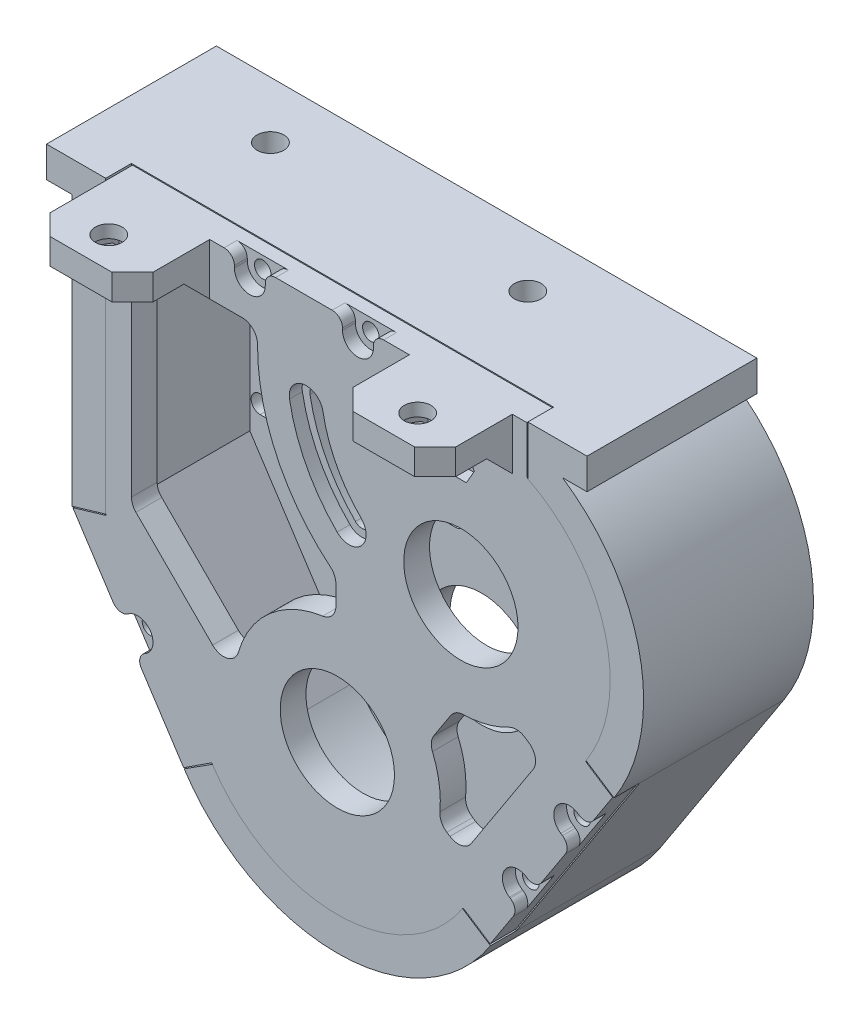
from build123d import *

# Parameters (mm, degrees)
SKETCH1_R           = 11.1
BOSS_EXTRUDE1_DEPTH = 5
BOSS_EXTRUDE2_DEPTH = 28
SKETCH4_W           = 105
SKETCH4_H           = 28
BOSS_EXTRUDE3_DEPTH = 6
BOSS_EXTRUDE4_DEPTH = 5
BOSS_EXTRUDE6_DEPTH = 5
CUT_EXTRUDE1_START  = -5
SKETCH7_R           = 11.1
CUT_EXTRUDE1_DEPTH  = 5
SKETCH8_R           = 1.85
CUT_EXTRUDE2_DEPTH  = 2.5
SKETCH8_2_R         = 1.85
CUT_EXTRUDE3_DEPTH  = 5
CUT_EXTRUDE4_DEPTH  = 5
CUT_EXTRUDE5_DEPTH  = 2.5
SKETCH11_W          = 20
SKETCH11_H          = 5
BOSS_EXTRUDE7_DEPTH = 15
CUT_EXTRUDE6_DEPTH  = 2.5
SKETCH12_3_R        = 1.6
CUT_EXTRUDE7_DEPTH  = 5
CUT_EXTRUDE8_DEPTH  = 5
SKETCH16_R          = 2.6
CUT_EXTRUDE9_DEPTH  = 2.5
SKETCH16_2_R        = 2.6
CUT_EXTRUDE10_DEPTH = 140.834848804
SKETCH17_R          = 2.6
CUT_EXTRUDE11_DEPTH = 2.5
SKETCH17_3_R        = 2.6
CUT_EXTRUDE12_DEPTH = 141.78017688
SKETCH18_R          = 1.5
CUT_EXTRUDE13_DEPTH = 8
CHAMFER1_SIZE       = 4
CHAMFER2_SIZE       = 5
FILLET3_R           = 3
FILLET4_R           = 3
FILLET5_R           = 2


with BuildPart() as part:
    # Sketch1 → Boss-Extrude1 (new body)
    with BuildSketch(Plane.XY):
        with BuildLine():
            Line((-21, -21), (-0.282868992, -52.731955723))
            ThreePointArc((-0.282868992, -52.731955723), (24.021245285, -65.878170047), (48.306071751, -52.696359647))
            Line((48.306071751, -52.696359647), (72.306071751, -15.818181818))
            ThreePointArc((72.306071751, -15.818181818), (73.492423117, 13.825207544), (48, 29))
            Line((48, 29), (-21, 29))
            Line((-21, 29), (-21, -21))
        make_face()
        with BuildLine():
            ThreePointArc((-19, -17.25), (-20.75, -15.5), (-19, -13.75))
            Line((-19, -13.75), (-12, -13.75))
            ThreePointArc((-12, -13.75), (-10.25, -15.5), (-12, -17.25))
            Line((-12, -17.25), (-19, -17.25))
        make_face(mode=Mode.SUBTRACT)
        with BuildLine():
            ThreePointArc((-3.5, -11.1), (-14.6, 0), (-3.5, 11.1))
            Line((-3.5, 11.1), (3.5, 11.1))
            ThreePointArc((3.5, 11.1), (14.6, 0), (3.5, -11.1))
            Line((3.5, -11.1), (-3.5, -11.1))
        make_face(mode=Mode.SUBTRACT)
        with BuildLine():
            ThreePointArc((-19, 13.75), (-20.75, 15.5), (-19, 17.25))
            Line((-19, 17.25), (-12, 17.25))
            ThreePointArc((-12, 17.25), (-10.25, 15.5), (-12, 13.75))
            Line((-12, 13.75), (-19, 13.75))
        make_face(mode=Mode.SUBTRACT)
        with BuildLine():
            ThreePointArc((12, 13.75), (10.25, 15.5), (12, 17.25))
            Line((12, 17.25), (19, 17.25))
            ThreePointArc((19, 17.25), (20.75, 15.5), (19, 13.75))
            Line((19, 13.75), (12, 13.75))
        make_face(mode=Mode.SUBTRACT)
        with BuildLine():
            Line((12, -13.75), (19, -13.75))
            ThreePointArc((19, -13.75), (20.75, -15.5), (19, -17.25))
            Line((19, -17.25), (12, -17.25))
            ThreePointArc((12, -17.25), (10.25, -15.5), (12, -13.75))
        make_face(mode=Mode.SUBTRACT)
        with Locations((24, -36.878177829)):
            Circle(SKETCH1_R, mode=Mode.SUBTRACT)
        with Locations((48, 0)):
            Circle(SKETCH1_R, mode=Mode.SUBTRACT)
    extrude(amount=BOSS_EXTRUDE1_DEPTH)

    # Sketch3 → Boss-Extrude2 (add)
    with BuildSketch(Plane(origin=(0, 0, 0), x_dir=(-1, 0, 0), z_dir=(0, 0, -1))):
        with BuildLine():
            Line((27.5, -22.934009153), (27.5, 35.5))
            Line((27.5, 35.5), (-48, 35.5))
            ThreePointArc((-48, 35.5), (-79.206242091, 16.923960959), (-77.753984385, -19.363636364))
            Line((-77.753984385, -19.363636364), (-53.753984385, -56.241814193))
            ThreePointArc((-53.753984385, -56.241814193), (-24.02600716, -72.378168303), (5.725581008, -56.285388699))
            Line((5.725581008, -56.285388699), (27.5, -22.934009153))
        make_face()
        with BuildLine():
            Line((21, -21), (21, 29))
            Line((21, 29), (-48, 29))
            ThreePointArc((-48, 29), (-73.492423117, 13.825207544), (-72.306071751, -15.818181818))
            Line((-72.306071751, -15.818181818), (-48.306071751, -52.696359647))
            ThreePointArc((-48.306071751, -52.696359647), (-24.021245285, -65.878170047), (0.282868992, -52.731955723))
            Line((0.282868992, -52.731955723), (21, -21))
        make_face(mode=Mode.SUBTRACT)
    extrude(amount=-BOSS_EXTRUDE2_DEPTH)

    # Sketch4 → Boss-Extrude3 (add)
    with BuildSketch(Plane(origin=(0, 35.5, 0), x_dir=(1, 0, 0), z_dir=(0, 1, 0))):
        with Locations((20, -14)):
            Rectangle(SKETCH4_W, SKETCH4_H)
    extrude(amount=-BOSS_EXTRUDE3_DEPTH)

    # Sketch5 → Boss-Extrude4 (add)
    with BuildSketch(Plane.XY.offset(28)):
        Polygon((-21, -21), (-21, 35.5), (-32.5, 35.5), (-32.5, 29.5), (-27.5, 29.5), (-27.5, -22.934009153), align=None)
        with BuildLine():
            ThreePointArc((77.753984385, -19.363636364), (82.778379659, 7.121397919), (67.748417658, 29.5))
            Line((67.748417658, 29.5), (72.5, 29.5))
            Line((72.5, 29.5), (72.5, 35.5))
            Line((72.5, 35.5), (61, 35.5))
            Line((61, 35.5), (61, 25.922962794))
            ThreePointArc((61, 25.922962794), (75.991365378, 7.581785031), (72.306071751, -15.818181818))
            Line((72.306071751, -15.818181818), (77.753984385, -19.363636364))
        make_face()
        with BuildLine():
            ThreePointArc((48.306071751, -52.696359647), (24.021245285, -65.878170047), (-0.282868992, -52.731955723))
            Line((-0.282868992, -52.731955723), (-5.753984385, -56.241814193))
            ThreePointArc((-5.753984385, -56.241814193), (24, -72.378177829), (53.753984385, -56.241814193))
            Line((53.753984385, -56.241814193), (48.306071751, -52.696359647))
        make_face()
    extrude(amount=BOSS_EXTRUDE4_DEPTH)

    # Sketch16 → Cut-Extrude9 (cut)
    # profile 1 of 2: a face of its own
    with BuildSketch(Plane.XZ.offset(-29)):
        Polygon((44.542562584, 11), (41.771281292, 15.8), (36.228718708, 15.8), (33.457437416, 11), (36.228718708, 6.2), (41.771281292, 6.2), align=None)
        with Locations((39, 11)):
            Circle(SKETCH16_R, mode=Mode.SUBTRACT)
    # profile 2 of 2: a face of its own
    with BuildSketch(Plane.XZ.offset(-29)):
        Polygon((-5.457437416, 11), (-8.228718708, 15.8), (-13.771281292, 15.8), (-16.542562584, 11), (-13.771281292, 6.2), (-8.228718708, 6.2), align=None)
        with Locations((-11, 11)):
            Circle(SKETCH16_R, mode=Mode.SUBTRACT)
    extrude(amount=-CUT_EXTRUDE9_DEPTH, mode=Mode.SUBTRACT)

    # Sketch16<2> → Cut-Extrude10 (cut, through all)
    with BuildSketch(Plane.XZ.offset(-29)):
        with Locations((-11, 11)):
            Circle(SKETCH16_2_R)
        with Locations((39, 11)):
            Circle(SKETCH16_2_R)
    extrude(amount=-CUT_EXTRUDE10_DEPTH, mode=Mode.SUBTRACT)

    # Sketch18 → Cut-Extrude13 (cut)
    with BuildSketch(Plane.XY.offset(28)):
        with Locations((69.045110685, -28)):
            Circle(SKETCH18_R)
        with Locations((59.068149044, -43.697173565)):
            Circle(SKETCH18_R)
        with Locations((28, 32.91148487)):
            Circle(SKETCH18_R)
        with Locations((7, 32.91148487)):
            Circle(SKETCH18_R)
        with Locations((-14.811227042, -38)):
            Circle(SKETCH18_R)
    extrude(amount=-CUT_EXTRUDE13_DEPTH, mode=Mode.SUBTRACT)


with BuildPart() as body_2:
    # Sketch6 → Boss-Extrude6 (new body)
    with BuildSketch(Plane.XY.offset(33)):
        with BuildLine():
            ThreePointArc((72.306071751, -15.818181818), (73.492423117, 13.825207544), (48, 29))
            Line((48, 29), (-21, 29))
            Line((-21, 29), (-21, -21))
            Line((-21, -21), (-0.282868992, -52.731955723))
            ThreePointArc((-0.282868992, -52.731955723), (24.021245285, -65.878170047), (48.306071751, -52.696359647))
            Line((48.306071751, -52.696359647), (72.306071751, -15.818181818))
        make_face()
        Polygon((-5.849135049, -56.0961438), (-0.406423034, -52.542710823), (-20.885926448, -21.17472385), (-27.385926448, -23.108733003), align=None)
        Polygon((53.695447213, -55.965095203), (77.477265395, -19.422173536), (72.364608923, -16.094900808), (48.582790741, -52.637822475), align=None)
        Polygon((48.306071751, -52.696359647), (72.306071751, -15.818181818), (72.364608923, -16.094900808), (48.582790741, -52.637822475), align=None)
        with BuildLine():
            ThreePointArc((48, 29), (54.679598752, 28.220257981), (61, 25.922962794))
            Line((61, 25.922962794), (60.8, 26.244999524))
            ThreePointArc((60.8, 26.244999524), (54.568333651, 28.451660638), (48, 29.2))
            Line((48, 29.2), (-20.8, 29.2))
            Line((-20.8, 29.2), (-21, 29))
            Line((-21, 29), (48, 29))
        make_face()
        with BuildLine():
            ThreePointArc((60.8, 26.244999524), (54.568333651, 28.451660638), (48, 29.2))
            Line((48, 29.2), (-20.8, 29.2))
            Line((-20.8, 29.2), (-20.8, 35.3))
            Line((-20.8, 35.3), (60.8, 35.3))
            Line((60.8, 35.3), (60.8, 26.244999524))
        make_face()
    extrude(amount=-BOSS_EXTRUDE6_DEPTH)

    # Sketch7 → Cut-Extrude1 (cut)
    with BuildSketch(Plane.XY.offset(33).offset(CUT_EXTRUDE1_START)):
        with Locations((24, -36.878177829)):
            Circle(SKETCH7_R)
        with Locations((48, 0)):
            Circle(SKETCH7_R)
    extrude(amount=CUT_EXTRUDE1_DEPTH, mode=Mode.SUBTRACT)

    # Sketch8 → Cut-Extrude2 (cut)
    with BuildSketch(Plane.XY.offset(33)):
        Polygon((50.617691454, 22), (49.058845727, 24.7), (45.941154273, 24.7), (44.382308546, 22), (45.941154273, 19.3), (49.058845727, 19.3), align=None)
        with Locations((47.5, 22)):
            Circle(SKETCH8_R, mode=Mode.SUBTRACT)
    extrude(amount=-CUT_EXTRUDE2_DEPTH, mode=Mode.SUBTRACT)

    # Sketch8<2> → Cut-Extrude3 (cut)
    with BuildSketch(Plane.XY.offset(33)):
        with Locations((47.5, 22)):
            Circle(SKETCH8_2_R)
    extrude(amount=-CUT_EXTRUDE3_DEPTH, mode=Mode.SUBTRACT)

    # Sketch9 → Cut-Extrude4 (cut)
    with BuildSketch(Plane.XY.offset(33)):
        with BuildLine():
            ThreePointArc((16.183113454, 16.47798795), (19.293055505, 7.316394099), (25.014004358, -0.485995642))
            ThreePointArc((25.014004358, -0.485995642), (27.559588771, -0.485995642), (27.559588771, 2.059588771))
            ThreePointArc((27.559588771, 2.059588771), (22.486294504, 8.978689107), (19.728421365, 17.10312139))
            ThreePointArc((19.728421365, 17.10312139), (17.64320069, 18.563208625), (16.183113454, 16.47798795))
        make_face()
    extrude(amount=-CUT_EXTRUDE4_DEPTH, mode=Mode.SUBTRACT)

    # Sketch10 → Cut-Extrude5 (cut)
    with BuildSketch(Plane.XY.offset(33)):
        with BuildLine():
            ThreePointArc((21.205632995, 17.363593656), (17.382728423, 20.040420255), (14.705901825, 16.217515684))
            ThreePointArc((14.705901825, 16.217515684), (17.962539255, 6.623771179), (23.953344186, -1.546655814))
            ThreePointArc((23.953344186, -1.546655814), (28.620248942, -1.546655814), (28.620248942, 3.120248942))
            ThreePointArc((28.620248942, 3.120248942), (23.816810754, 9.671312027), (21.205632995, 17.363593656))
        make_face()
    extrude(amount=-CUT_EXTRUDE5_DEPTH, mode=Mode.SUBTRACT)

    # Sketch11 → Boss-Extrude7 (add)
    with BuildSketch(Plane.XY.offset(33)):
        with Locations((-10.8, 32.8)):
            Rectangle(SKETCH11_W, SKETCH11_H)
        with Locations((48, 32.8)):
            Rectangle(SKETCH11_W, SKETCH11_H)
    extrude(amount=BOSS_EXTRUDE7_DEPTH)

    # Sketch12 → Cut-Extrude6 (cut)
    with BuildSketch(Plane.XY.offset(33)):
        with BuildLine():
            Line((4, 32.91148487), (4, 37.68851513))
            ThreePointArc((4, 37.68851513), (7, 40.68851513), (10, 37.68851513))
            Line((10, 37.68851513), (10, 32.91148487))
            ThreePointArc((10, 32.91148487), (7, 29.91148487), (4, 32.91148487))
        make_face()
        with BuildLine():
            Line((25, 32.91148487), (25, 37.68851513))
            ThreePointArc((25, 37.68851513), (28, 40.68851513), (31, 37.68851513))
            Line((31, 37.68851513), (31, 32.91148487))
            ThreePointArc((31, 32.91148487), (28, 29.91148487), (25, 32.91148487))
        make_face()
        with BuildLine():
            Line((70.681474321, -25.485578784), (74.6852964, -28.091231654))
            ThreePointArc((74.6852964, -28.091231654), (75.563353979, -32.242016506), (71.412569127, -33.120074085))
            Line((71.412569127, -33.120074085), (67.408747048, -30.514421216))
            ThreePointArc((67.408747048, -30.514421216), (66.530689469, -26.363636364), (70.681474321, -25.485578784))
        make_face()
        with BuildLine():
            Line((60.704512681, -41.18275235), (64.708334759, -43.788405219))
            ThreePointArc((64.708334759, -43.788405219), (65.586392339, -47.939190071), (61.435607487, -48.81724765))
            Line((61.435607487, -48.81724765), (57.431785408, -46.211594781))
            ThreePointArc((57.431785408, -46.211594781), (56.553727829, -42.060809929), (60.704512681, -41.18275235))
        make_face()
        with BuildLine():
            Line((-13.171181053, -40.51202093), (-17.171181053, -43.12353737))
            ThreePointArc((-17.171181053, -43.12353737), (-21.323247972, -42.251562429), (-20.451273031, -38.099495509))
            Line((-20.451273031, -38.099495509), (-16.451273031, -35.48797907))
            ThreePointArc((-16.451273031, -35.48797907), (-12.299206111, -36.359954011), (-13.171181053, -40.51202093))
        make_face()
    extrude(amount=-CUT_EXTRUDE6_DEPTH, mode=Mode.SUBTRACT)

    # Sketch12<3> → Cut-Extrude7 (cut)
    with BuildSketch(Plane.XY.offset(33)):
        with Locations((-14.811227042, -38)):
            Circle(SKETCH12_3_R)
        with Locations((59.068149044, -43.697173565)):
            Circle(SKETCH12_3_R)
        with Locations((69.045110685, -28)):
            Circle(SKETCH12_3_R)
        with Locations((28, 32.91148487)):
            Circle(SKETCH12_3_R)
        with Locations((7, 32.91148487)):
            Circle(SKETCH12_3_R)
    extrude(amount=-CUT_EXTRUDE7_DEPTH, mode=Mode.SUBTRACT)

    # Sketch13 → Cut-Extrude8 (cut)
    with BuildSketch(Plane.XY.offset(33)):
        with BuildLine():
            Line((23.720024014, -16.880137589), (23.720024014, -8.91136914))
            ThreePointArc((23.720024014, -8.91136914), (11.813163722, 6.269465474), (8.639866187, 25.3))
            Line((8.639866187, 25.3), (-16, 25.3))
            Line((-16, 25.3), (-16, -16.878177829))
            Line((-16, -16.878177829), (4, -36.878177829))
            ThreePointArc((4, -36.878177829), (9.759221936, -22.835377534), (23.720024014, -16.880137589))
        make_face()
        with BuildLine():
            Line((46.933854193, -19.971563112), (41.828953912, -27.815705627))
            ThreePointArc((41.828953912, -27.815705627), (43.782713631, -33.93806875), (43.693883081, -40.364001863))
            Line((43.693883081, -40.364001863), (48.381101403, -43.414403113))
            Line((48.381101403, -43.414403113), (63.653828675, -19.946471767))
            Line((63.653828675, -19.946471767), (58.835288554, -16.810607423))
            ThreePointArc((58.835288554, -16.810607423), (53.133901803, -19.329848739), (46.933854193, -19.971563112))
        make_face()
    extrude(amount=-CUT_EXTRUDE8_DEPTH, mode=Mode.SUBTRACT)

    # Sketch17 → Cut-Extrude11 (cut)
    # profile 1 of 2: a face of its own
    with BuildSketch(Plane.XZ.offset(-30.3)):
        Polygon((51.371281292, 37.2), (54.142562584, 42), (51.371281292, 46.8), (45.828718708, 46.8), (43.057437416, 42), (45.828718708, 37.2), align=None)
        with Locations(Location((48.6, 42, 0), (0, 0, 270))):
            Circle(SKETCH17_R, mode=Mode.SUBTRACT)
    # profile 2 of 2: a face of its own
    with BuildSketch(Plane.XZ.offset(-30.3)):
        Polygon((-8.628718708, 37.2), (-5.857437416, 42), (-8.628718708, 46.8), (-14.171281292, 46.8), (-16.942562584, 42), (-14.171281292, 37.2), align=None)
        with Locations(Location((-11.4, 42, 0), (0, 0, 270))):
            Circle(SKETCH17_R, mode=Mode.SUBTRACT)
    extrude(amount=-CUT_EXTRUDE11_DEPTH, mode=Mode.SUBTRACT)

    # Sketch17<3> → Cut-Extrude12 (cut, through all)
    with BuildSketch(Plane.XZ.offset(-30.3)):
        with Locations(Location((-11.4, 42, 0), (0, 0, 270))):
            Circle(SKETCH17_3_R)
        with Locations(Location((48.6, 42, 0), (0, 0, 270))):
            Circle(SKETCH17_3_R)
    extrude(amount=-CUT_EXTRUDE12_DEPTH, mode=Mode.SUBTRACT)

    # Chamfer1
    chamfer1_edges = [body_2.edges().sort_by_distance(p)[0] for p in [
        (-0.8, 32.8, 48),
        (-20.8, 32.8, 48),
        (58, 32.8, 48),
        (38, 32.8, 48),
    ]]
    chamfer(chamfer1_edges, length=CHAMFER1_SIZE)

    # Chamfer2
    # the kernel refuses this chamfer: 5 mm, written as the material it adds along each edge
    with BuildSketch(Plane(origin=(38, 30.3, 33), x_dir=(0, -0.9996219169112968, -0.027495876610586317), z_dir=(1, 0, 0))) as chamfer2_piece_1_section:
        Polygon((CHAMFER2_SIZE * 0.999621916911, -CHAMFER2_SIZE * 0.0274958766106), (-CHAMFER2_SIZE * 0.0274958766106, -CHAMFER2_SIZE * 0.999621916911), (0, 0), align=None)
    chamfer2_piece_1 = extrude(amount=20, mode=Mode.PRIVATE)
    chamfer2_piece_1 = split(chamfer2_piece_1, bisect_by=Plane(origin=(42.020951887, 29.344575239, 37.2), z_dir=(0, 0, -1)), keep=Keep.TOP, mode=Mode.PRIVATE)
    add(chamfer2_piece_1)
    with BuildSketch(Plane(origin=(38, 30.3, 33), x_dir=(0, -0.9996219169112968, -0.027495876610586317), z_dir=(1, 0, 0))) as chamfer2_piece_2_section:
        Polygon((CHAMFER2_SIZE * 0.999621916911, -CHAMFER2_SIZE * 0.0274958766106), (-CHAMFER2_SIZE * 0.0274958766106, -CHAMFER2_SIZE * 0.999621916911), (0, 0), align=None)
    chamfer2_piece_2 = extrude(amount=32.85841494, mode=Mode.PRIVATE)
    chamfer2_piece_2 = split(chamfer2_piece_2, bisect_by=Plane(origin=(44.716765037, 30.031995962, 39.125960253), z_dir=(-0.8660254037844394, 0, -0.4999999999999987)), keep=Keep.TOP, mode=Mode.PRIVATE)
    add(chamfer2_piece_2)
    with BuildSketch(Plane(origin=(25.14158506, 30.3, 33), x_dir=(0, -0.9996219169112968, -0.027495876610586317), z_dir=(1, 0, 0))) as chamfer2_piece_3_section:
        Polygon((CHAMFER2_SIZE * 0.999621916911, -CHAMFER2_SIZE * 0.0274958766106), (-CHAMFER2_SIZE * 0.0274958766106, -CHAMFER2_SIZE * 0.999621916911), (0, 0), align=None)
    chamfer2_piece_3 = extrude(amount=32.85841494, mode=Mode.PRIVATE)
    chamfer2_piece_3 = split(chamfer2_piece_3, bisect_by=Plane(origin=(52.332984532, 30.0317481, 38.865718873), z_dir=(0.8660254037844386, 0, -0.5000000000000001)), keep=Keep.TOP, mode=Mode.PRIVATE)
    add(chamfer2_piece_3)
    with BuildSketch(Plane(origin=(-20.8, 30.3, 33), x_dir=(0, -0.9996219169112968, -0.027495876610586317), z_dir=(1, 0, 0))) as chamfer2_piece_4_section:
        Polygon((CHAMFER2_SIZE * 0.999621916911, -CHAMFER2_SIZE * 0.0274958766106), (-CHAMFER2_SIZE * 0.0274958766106, -CHAMFER2_SIZE * 0.999621916911), (0, 0), align=None)
    chamfer2_piece_4 = extrude(amount=32.85841494, mode=Mode.PRIVATE)
    chamfer2_piece_4 = split(chamfer2_piece_4, bisect_by=Plane(origin=(-14.825782648, 29.934368224, 38.333629602), z_dir=(-0.8660254037844388, 0, -0.49999999999999983)), keep=Keep.TOP, mode=Mode.PRIVATE)
    add(chamfer2_piece_4)
    with BuildSketch(Plane(origin=(-33.65841494, 30.3, 33), x_dir=(0, -0.9996219169112968, -0.027495876610586317), z_dir=(1, 0, 0))) as chamfer2_piece_5_section:
        Polygon((CHAMFER2_SIZE * 0.999621916911, -CHAMFER2_SIZE * 0.0274958766106), (-CHAMFER2_SIZE * 0.0274958766106, -CHAMFER2_SIZE * 0.999621916911), (0, 0), align=None)
    chamfer2_piece_5 = extrude(amount=32.85841494, mode=Mode.PRIVATE)
    chamfer2_piece_5 = split(chamfer2_piece_5, bisect_by=Plane(origin=(-21.531871682, 28.468128318, 34.267251327), z_dir=(0.7071067811865476, -0.7071067811865476, 0)), keep=Keep.TOP, mode=Mode.PRIVATE)
    chamfer2_piece_5 = split(chamfer2_piece_5, bisect_by=Plane(origin=(-21, 27.834502654, 34.267251327), z_dir=(1, 0, 0)), keep=Keep.TOP, mode=Mode.PRIVATE)
    chamfer2_piece_5 = split(chamfer2_piece_5, bisect_by=Plane(origin=(-20.898246019, 27.834502654, 37.2), z_dir=(0, 0, -1)), keep=Keep.TOP, mode=Mode.PRIVATE)
    add(chamfer2_piece_5)
    with BuildSketch(Plane(origin=(-33.65841494, 30.3, 33), x_dir=(0, -0.9996219169112968, -0.027495876610586317), z_dir=(1, 0, 0))) as chamfer2_piece_6_section:
        Polygon((CHAMFER2_SIZE * 0.999621916911, -CHAMFER2_SIZE * 0.0274958766106), (-CHAMFER2_SIZE * 0.0274958766106, -CHAMFER2_SIZE * 0.999621916911), (0, 0), align=None)
    chamfer2_piece_6 = extrude(amount=32.85841494, mode=Mode.PRIVATE)
    chamfer2_piece_6 = split(chamfer2_piece_6, bisect_by=Plane(origin=(-7.516765037, 30.031995962, 39.125960253), z_dir=(0.8660254037844384, 0, -0.5000000000000004)), keep=Keep.TOP, mode=Mode.PRIVATE)
    add(chamfer2_piece_6)

    # Fillet3
    # the kernel refuses this fillet: 3 mm, written as the material it adds along each edge
    with BuildSketch(Plane(origin=(-16, 25.3, 33), x_dir=(1, 0, 0), z_dir=(0, 0, -1))) as fillet3_piece_1_section:
        with BuildLine():
            CenterArc((FILLET3_R, FILLET3_R), FILLET3_R, 180, 90)
            Line((0, FILLET3_R), (0, 0))
            Line((0, 0), (FILLET3_R, 0))
        make_face()
    fillet3_piece_1 = extrude(amount=5, mode=Mode.PRIVATE)
    fillet3_piece_1 = split(fillet3_piece_1, bisect_by=Plane(origin=(-15.680582454, 24.332234384, 32.032234384), z_dir=(0, -0.7071067811868302, 0.7071067811862648)), keep=Keep.TOP, mode=Mode.PRIVATE)
    add(fillet3_piece_1)
    with BuildSketch(Plane(origin=(-16, 25.3, 33), x_dir=(1, 0, 0), z_dir=(0, 0, -1))) as fillet3_piece_2_section:
        with BuildLine():
            CenterArc((FILLET3_R, FILLET3_R), FILLET3_R, 180, 90)
            Line((0, FILLET3_R), (0, 0))
            Line((0, 0), (FILLET3_R, 0))
        make_face()
    fillet3_piece_2 = extrude(amount=5, mode=Mode.PRIVATE)
    fillet3_piece_2 = split(fillet3_piece_2, bisect_by=Plane(origin=(-15.264031678, 23.612262934, 31.312262934), z_dir=(0, 0.7071067811868302, -0.7071067811862648)), keep=Keep.TOP, mode=Mode.PRIVATE)
    add(fillet3_piece_2)
    with BuildSketch(Plane(origin=(-16, -16.878177829, 33), x_dir=(0, 1, 0), z_dir=(0, 0, -1))) as fillet3_piece_3:
        with BuildLine():
            CenterArc((FILLET3_R * 0.414213562373, FILLET3_R), FILLET3_R, 225, 45)
            Line((-FILLET3_R * 0.292893218813, FILLET3_R * 0.292893218813), (0, 0))
            Line((0, 0), (FILLET3_R * 0.414213562373, 0))
        make_face()
    extrude(amount=5)
    with BuildSketch(Plane(origin=(4, -36.878177829, 33), x_dir=(-0.7071067811865487, 0.7071067811865464, 0), z_dir=(0, 0, -1))) as fillet3_piece_4:
        with BuildLine():
            CenterArc((5.978818969, 3), FILLET3_R, 151.024166262, 118.975833738)
            ThreePointArc((3.354346631, 4.453322038), (1.833112563, 2.10920392), (0, 0))
            Line((0, 0), (5.978818969, 0))
        make_face()
    extrude(amount=5)
    with BuildSketch(Plane(origin=(23.720024014, -16.880137589, 33), x_dir=(-0.9969167405298058, -0.07846663272645106, 0), z_dir=(0, 0, -1))) as fillet3_piece_5:
        with BuildLine():
            CenterArc((2.773642182, 2.99375248), FILLET3_R, 184.500433174, 81.80123197)
            Line((-0.217108039, 2.758352582), (0, 0))
            ThreePointArc((0, 0), (1.290066131, 0.041650134), (2.580132263, 0))
        make_face()
    extrude(amount=5)
    with BuildSketch(Plane(origin=(23.720024014, -8.91136914, 33), x_dir=(0, -1, 0), z_dir=(0, 0, -1))) as fillet3_piece_6:
        with BuildLine():
            CenterArc((1.443427818, 3), FILLET3_R, 219.614463602, 50.385536398)
            ThreePointArc((-0.867629108, 1.087144572), (-0.428967588, 0.547440556), (0, 0))
            Line((0, 0), (1.443427818, 0))
        make_face()
    extrude(amount=5)
    with BuildSketch(Plane(origin=(8.639866187, 25.3, 33), x_dir=(-1, 0, 0), z_dir=(0, 0, -1))) as fillet3_piece_7:
        with BuildLine():
            CenterArc((3.138794744, -3), FILLET3_R, 90, 90.409259048)
            ThreePointArc((0.138871276, -3.021428571), (0.09873726, -1.509367521), (0, 0))
            Line((0, 0), (3.138794744, 0))
        make_face()
    extrude(amount=5)

    # Fillet4
    fillet4_edges = [body_2.edges().sort_by_distance(p)[0] for p in [
        (48.381101403, -43.414403113, 30.5),
        (63.653828675, -19.946471767, 30.5),
        (58.835288554, -16.810607423, 30.5),
        (46.933854193, -19.971563112, 30.5),
        (41.828953912, -27.815705627, 30.5),
        (43.693883081, -40.364001863, 30.5),
    ]]
    fillet(fillet4_edges, radius=FILLET4_R)

    # Fillet5
    fillet5_edges = [body_2.edges().sort_by_distance(p)[0] for p in [
        (10, 35.3, 31.75),
        (4, 35.3, 31.75),
        (31, 35.3, 31.75),
        (25, 35.3, 31.75),
        (-18.451273031, -36.79373729, 31.75),
        (-15.171181053, -41.81777915, 31.75),
        (69.410658087, -31.81724765, 31.75),
        (72.68338536, -26.788405219, 31.75),
        (59.266068366, -47.405330307, 31.75),
        (62.538795639, -42.376487875, 31.75),
    ]]
    fillet(fillet5_edges, radius=FILLET5_R)


solid = Compound([part.part, body_2.part])
